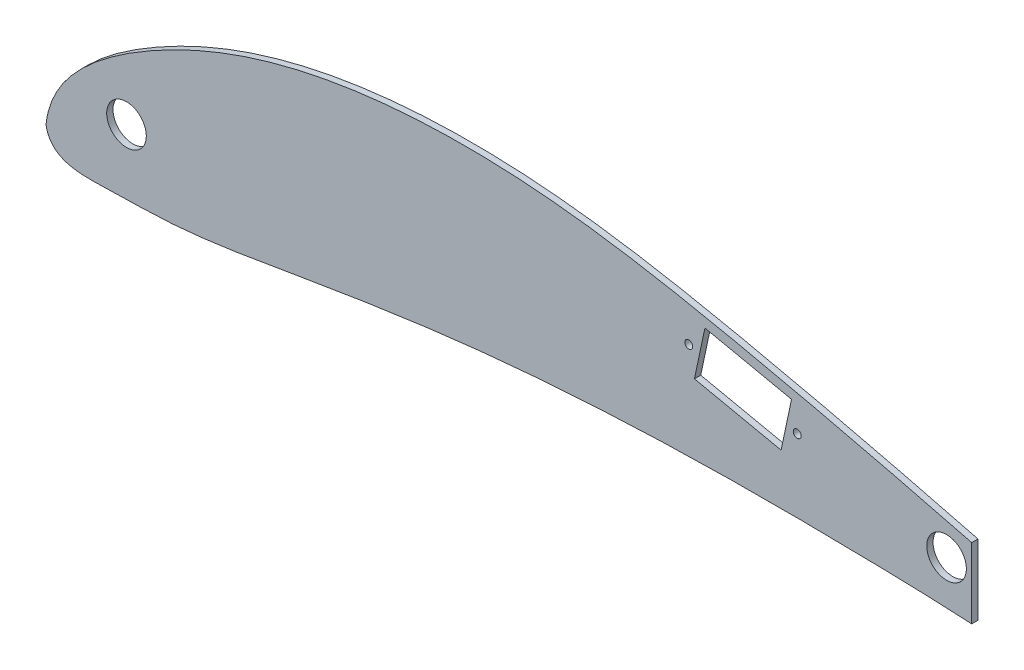
from build123d import *

# Parameters (mm, degrees)
BOSS_EXTRUDE1_DEPTH = 1.5875
SKETCH2_R           = 5
CUT_EXTRUDE1_DEPTH  = 316.731983488
SKETCH3_W           = 116.84
SKETCH3_H           = 50.8
CUT_EXTRUDE2_DEPTH  = 316.731983488
SKETCH4_R           = 1
CUT_EXTRUDE3_DEPTH  = 239.581081252


with BuildPart() as part:
    # Sketch1 → Boss-Extrude1 (new body)
    with BuildSketch(Plane.XY):
        with BuildLine():
            add(Edge.make_bspline(
                [(0.000560351, 0.000130087), (0.810633127, 7.359196055), (8.649092025, 17.856605174), (26.286719818, 29.975176328), (52.111128271, 42.069215275), (89.597618475, 49.290763054), (131.400792109, 47.884831915), (173.256699242, 40.041104278), (217.961060472, 29.612974894), (256.952064401, 19.528920948), (290.35983767, 8.71099439), (301.273197721, 4.382828139), (314.816918223, -0.516206742), (309.846313895, 0.000130087)],
                knots=[0, 0, 0, 0, 0.060863618, 0.113688265, 0.188608742, 0.312908923, 0.448482434, 0.557612135, 0.691544113, 0.852438279, 0.92975597, 0.976058229, 1, 1, 1, 1], degree=3))
            add(Edge.make_bspline(
                [(309.846313895, 0.000130087), (303.956832565, 1.47095521), (293.989507544, 2.093987313), (276.26402299, 4.514356704), (260.846344817, 5.427413394), (235.858814759, 7.870306192), (205.101424636, 8.838080282), (157.718638092, 9.030650149), (110.497331172, 6.181495223), (66.506197185, -0.586669107), (36.454672816, -6.098499901), (15.316603331, -6.189065841), (1.230714189, -6.924076091), (0.000560351, 0.000130087)],
                knots=[0, 0, 0, 0, 0.057787081, 0.095274891, 0.171021118, 0.205339302, 0.335319146, 0.464904334, 0.658702312, 0.785511947, 0.893517288, 0.94309214, 1, 1, 1, 1], degree=3))
        make_face()
    extrude(amount=BOSS_EXTRUDE1_DEPTH)

    # Sketch2 → Cut-Extrude1 (cut, through all)
    with BuildSketch(Plane.XY.offset(1.5875)):
        with Locations((20.32, 10.16)):
            Circle(SKETCH2_R)
        with Locations((227.296313895, 19.050130087)):
            Circle(SKETCH2_R)
    extrude(amount=-CUT_EXTRUDE1_DEPTH, mode=Mode.SUBTRACT)

    # Sketch3 → Cut-Extrude2 (cut, through all)
    with BuildSketch(Plane.XY.offset(1.5875)):
        with Locations((292.066313895, 19.050130087)):
            Rectangle(SKETCH3_W, SKETCH3_H)
    extrude(amount=-CUT_EXTRUDE2_DEPTH, mode=Mode.SUBTRACT)

    # Sketch4 → Cut-Extrude3 (cut, through all)
    with BuildSketch(Plane.XY.offset(1.5875)):
        with Locations((189.612462589, 27.237466494)):
            Circle(SKETCH4_R)
        with Locations((162.224329768, 33.058993837)):
            Circle(SKETCH4_R)
        Polygon((166.306857829, 38.683088487), (188.170413001, 34.035846374), (185.529934528, 21.613371845), (163.666379356, 26.260613958), align=None)
    extrude(amount=-CUT_EXTRUDE3_DEPTH, mode=Mode.SUBTRACT)


solid = part.part
